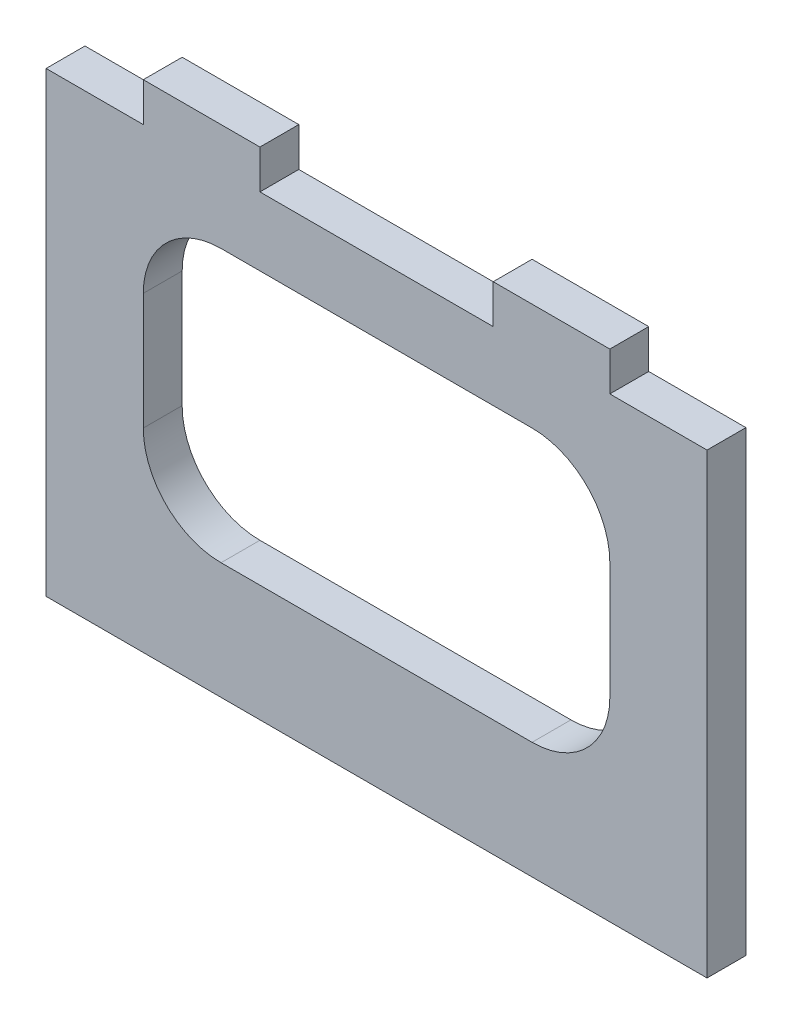
from build123d import *

# Parameters (mm, degrees)
SKIZZE1_W                       = 85
SKIZZE1_H                       = 58.8
AUFSATZ_LINEAR_AUSTRAGEN1_DEPTH = 5
SKIZZE2_W                       = 60
SKIZZE2_H                       = 35
SCHNITT_LINEAR_AUSTRAGEN1_DEPTH = 104.476760676
VERRUNDUNG1_R                   = 10
SKIZZE3_W                       = 15
SKIZZE3_H                       = 5
AUFSATZ_LINEAR_AUSTRAGEN2_DEPTH = 5


with BuildPart() as part:
    # Skizze1 → Aufsatz-Linear austragen1 (new body)
    with BuildSketch(Plane.XY):
        with Locations((42.5, 29.4)):
            Rectangle(SKIZZE1_W, SKIZZE1_H)
    extrude(amount=AUFSATZ_LINEAR_AUSTRAGEN1_DEPTH)

    # Skizze2 → Schnitt-Linear austragen1 (cut, through all)
    with BuildSketch(Plane.XY.offset(5)):
        with Locations((42.5, 32.5)):
            Rectangle(SKIZZE2_W, SKIZZE2_H)
    extrude(amount=-SCHNITT_LINEAR_AUSTRAGEN1_DEPTH, mode=Mode.SUBTRACT)

    # Verrundung1
    verrundung1_edges = [part.edges().sort_by_distance(p)[0] for p in [
        (12.5, 15, 2.5),
        (72.5, 15, 2.5),
        (72.5, 50, 2.5),
        (12.5, 50, 2.5),
    ]]
    fillet(verrundung1_edges, radius=VERRUNDUNG1_R)

    # Skizze3 → Aufsatz-Linear austragen2 (add)
    with BuildSketch(Plane(origin=(0, 58.8, 0), x_dir=(1, 0, 0), z_dir=(0, 1, 0))):
        with Locations((65, -2.5)):
            Rectangle(SKIZZE3_W, SKIZZE3_H)
        with Locations((20, -2.5)):
            Rectangle(SKIZZE3_W, SKIZZE3_H)
    extrude(amount=AUFSATZ_LINEAR_AUSTRAGEN2_DEPTH)


solid = part.part
